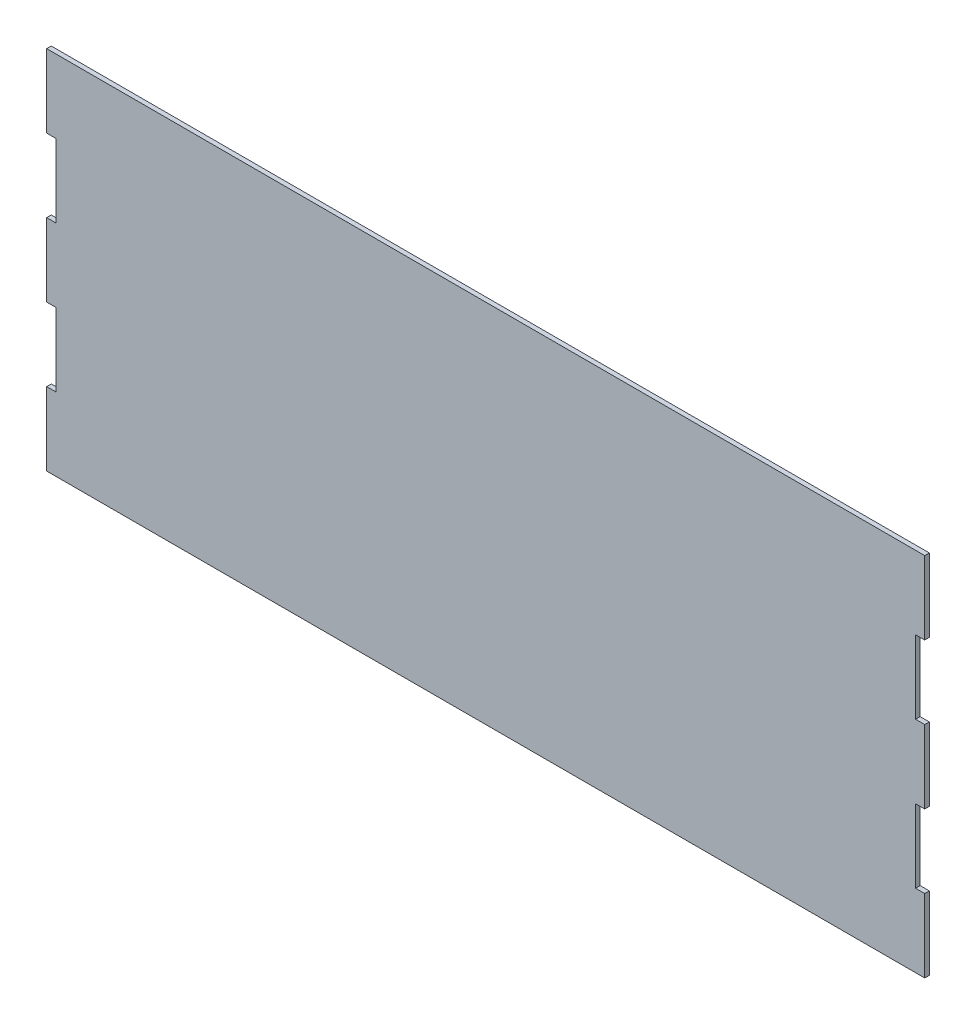
from build123d import *

# Parameters (mm, degrees)
BOSS_EXTRUDE1_DEPTH = 3.175


with BuildPart() as part:
    # Sketch1 → Boss-Extrude1 (new body)
    with BuildSketch(Plane.XY):
        Polygon((0, 254), (0, 203.2), (6.35, 203.2), (6.35, 152.4), (0, 152.4), (0, 101.6), (6.35, 101.6), (6.35, 50.8), (0, 50.8), (0, 0), (6.35, 0), (609.6, 0), (609.6, 50.8), (603.25, 50.8), (603.25, 101.6), (609.6, 101.6), (609.6, 152.4), (603.25, 152.4), (603.25, 203.2), (609.6, 203.2), (609.6, 254), align=None)
    extrude(amount=BOSS_EXTRUDE1_DEPTH)


solid = part.part
